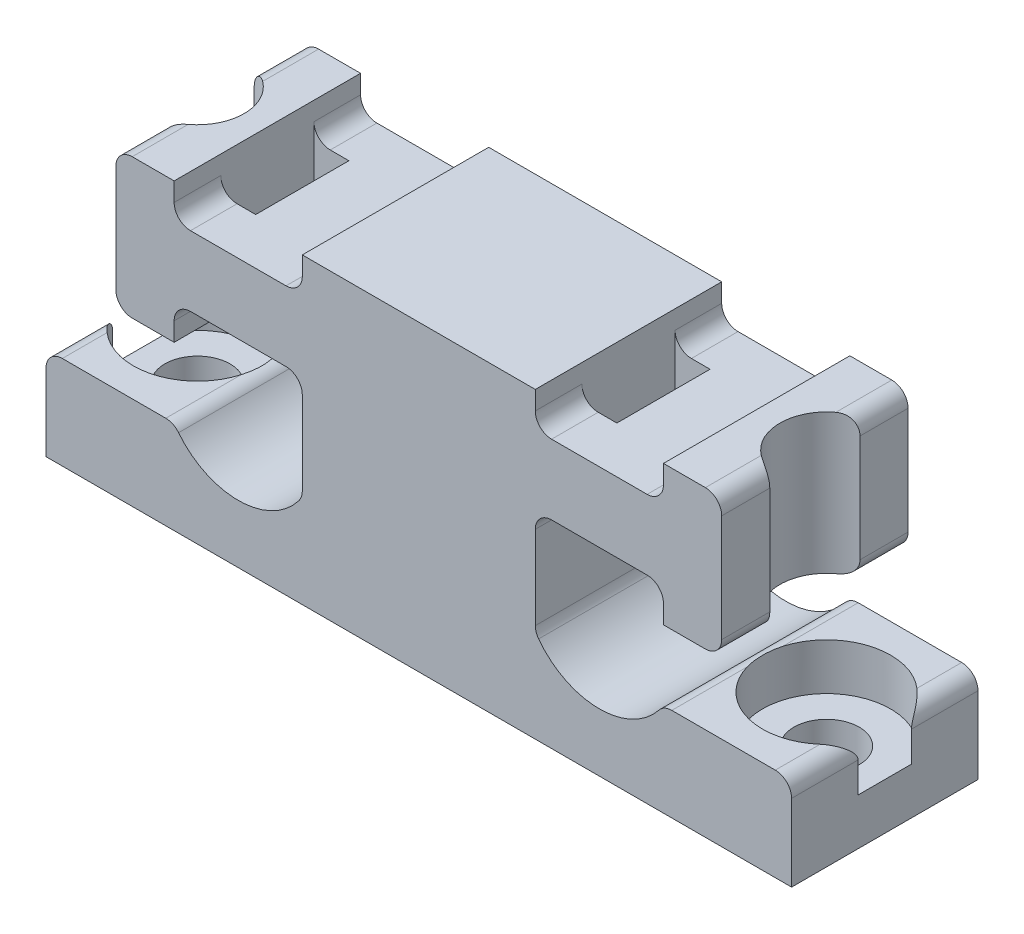
from build123d import *

# Parameters (mm, degrees)
BOSS_EXTRUDE1_DEPTH     = 8
SKETCH4_W               = 5.5
SKETCH4_H               = 1.5
CUT_EXTRUDE2_DEPTH      = 23.113344387
CUT_EXTRUDE6_DEPTH      = 23.113344387
FILLET1_R               = 0.7
CUT_EXTRUDE1_DEPTH      = 21.024984395
CUT_EXTRUDE1_DEPTH_BACK = 21.024984395
SKETCH2_R               = 1.4
CUT_EXTRUDE3_REACH      = 24.113
SKETCH5_W               = 1.5
SKETCH5_H               = 4
SKETCH6_R               = 2.75
CUT_EXTRUDE5_DEPTH      = 2
SKETCH8_R               = 2
CUT_EXTRUDE7_DEPTH      = 22.000000167


with BuildPart() as part:
    # Sketch1 → Boss-Extrude1 (new body)
    with BuildSketch(Plane.XY):
        Polygon((13, 13), (-13, 13), (-13, 7), (-5, 7), (-5, 4), (-16, 4), (-16, 0), (16, 0), (16, 4), (5, 4), (5, 7), (13, 7), align=None)
    extrude(amount=BOSS_EXTRUDE1_DEPTH)

    # Sketch4 → Cut-Extrude2 (cut, through all)
    with BuildSketch(Plane.XY.offset(8)):
        with Locations((-7.75, 7.75)):
            Rectangle(SKETCH4_W, SKETCH4_H)
        with Locations((-7.75, 12.25)):
            Rectangle(SKETCH4_W, SKETCH4_H)
        with Locations((7.75, 12.25)):
            Rectangle(SKETCH4_W, SKETCH4_H)
        with Locations((7.75, 7.75)):
            Rectangle(SKETCH4_W, SKETCH4_H)
    extrude(amount=-CUT_EXTRUDE2_DEPTH, mode=Mode.SUBTRACT)

    # Sketch7 → Cut-Extrude6 (cut, through all)
    with BuildSketch(Plane.XY.offset(8)):
        with BuildLine():
            Line((-10.5, 4), (-5, 4))
            ThreePointArc((-5, 4), (-7.75, 2.5), (-10.5, 4))
        make_face()
        with BuildLine():
            Line((10.5, 4), (5, 4))
            ThreePointArc((5, 4), (7.75, 2.5), (10.5, 4))
        make_face()
    extrude(amount=-CUT_EXTRUDE6_DEPTH, mode=Mode.SUBTRACT)

    # Fillet1
    fillet1_edges = [part.edges().sort_by_distance(p)[0] for p in [
        (16, 4, 4),
        (-16, 4, 4),
        (-5, 8.5, 4),
        (-10.5, 8.5, 4),
        (-13, 7, 4),
        (-13, 13, 4),
        (-10.5, 11.5, 4),
        (-5, 11.5, 4),
        (5, 11.5, 4),
        (10.5, 11.5, 4),
        (13, 13, 4),
        (13, 7, 4),
        (10.5, 8.5, 4),
        (5, 8.5, 4),
        (-10.5, 4, 4),
        (-5, 4, 4),
        (10.5, 4, 4),
        (5, 4, 4),
    ]]
    fillet(fillet1_edges, radius=FILLET1_R)

    # Sketch2 → Cut-Extrude1 (cut, two sides: drawn at the far end of the back side and taken through both)
    with BuildSketch(Plane(origin=(0, 4, 0), x_dir=(1, 0, 0), z_dir=(0, 1, 0)).offset(-CUT_EXTRUDE1_DEPTH_BACK)):
        with Locations((-13.5, -4)):
            Circle(SKETCH2_R)
        with Locations((13.5, -4)):
            Circle(SKETCH2_R)
    extrude(amount=CUT_EXTRUDE1_DEPTH + CUT_EXTRUDE1_DEPTH_BACK, mode=Mode.SUBTRACT)

    # Sketch5 → Cut-Extrude3 (cut, up to next)
    with BuildSketch(Plane(origin=(0, 13, 0), x_dir=(1, 0, 0), z_dir=(0, 1, 0)), mode=Mode.PRIVATE) as cut_extrude3_sk1:
        with Locations((-9.75, -4)):
            Rectangle(SKETCH5_W, SKETCH5_H)
    cut_extrude3_tool1 = extrude(cut_extrude3_sk1.sketch, amount=-CUT_EXTRUDE3_REACH, mode=Mode.PRIVATE) & part.part
    # Sketch5 → Cut-Extrude3 (cut, up to next)
    with BuildSketch(Plane(origin=(0, 13, 0), x_dir=(1, 0, 0), z_dir=(0, 1, 0)), mode=Mode.PRIVATE) as cut_extrude3_sk2:
        with Locations((-5.75, -4)):
            Rectangle(SKETCH5_W, SKETCH5_H)
    cut_extrude3_tool2 = extrude(cut_extrude3_sk2.sketch, amount=-CUT_EXTRUDE3_REACH, mode=Mode.PRIVATE) & part.part
    # Sketch5 → Cut-Extrude3 (cut, up to next)
    with BuildSketch(Plane(origin=(0, 13, 0), x_dir=(1, 0, 0), z_dir=(0, 1, 0)), mode=Mode.PRIVATE) as cut_extrude3_sk3:
        with Locations((5.75, -4)):
            Rectangle(SKETCH5_W, SKETCH5_H)
    cut_extrude3_tool3 = extrude(cut_extrude3_sk3.sketch, amount=-CUT_EXTRUDE3_REACH, mode=Mode.PRIVATE) & part.part
    # Sketch5 → Cut-Extrude3 (cut, up to next)
    with BuildSketch(Plane(origin=(0, 13, 0), x_dir=(1, 0, 0), z_dir=(0, 1, 0)), mode=Mode.PRIVATE) as cut_extrude3_sk4:
        with Locations((9.75, -4)):
            Rectangle(SKETCH5_W, SKETCH5_H)
    cut_extrude3_tool4 = extrude(cut_extrude3_sk4.sketch, amount=-CUT_EXTRUDE3_REACH, mode=Mode.PRIVATE) & part.part
    add(cut_extrude3_tool1.solids().sort_by_distance((-9.75, 13, 4))[0], mode=Mode.SUBTRACT)
    add(cut_extrude3_tool2.solids().sort_by_distance((-5.75, 13, 4))[0], mode=Mode.SUBTRACT)
    add(cut_extrude3_tool3.solids().sort_by_distance((5.75, 13, 4))[0], mode=Mode.SUBTRACT)
    add(cut_extrude3_tool4.solids().sort_by_distance((9.75, 13, 4))[0], mode=Mode.SUBTRACT)

    # Sketch6 → Cut-Extrude5 (cut)
    with BuildSketch(Plane(origin=(0, 4, 0), x_dir=(1, 0, 0), z_dir=(0, 1, 0))):
        with Locations((13.5, -4)):
            Circle(SKETCH6_R)
        with Locations((-13.5, -4)):
            Circle(SKETCH6_R)
    extrude(amount=-CUT_EXTRUDE5_DEPTH, mode=Mode.SUBTRACT)

    # Sketch8 → Cut-Extrude7 (cut, through all)
    with BuildSketch(Plane(origin=(0, 2, 0), x_dir=(1, 0, 0), z_dir=(0, 1, 0))):
        with Locations((-13.5, -4)):
            Circle(SKETCH8_R)
        with Locations((13.5, -4)):
            Circle(SKETCH8_R)
    extrude(amount=CUT_EXTRUDE7_DEPTH, mode=Mode.SUBTRACT)


solid = part.part
